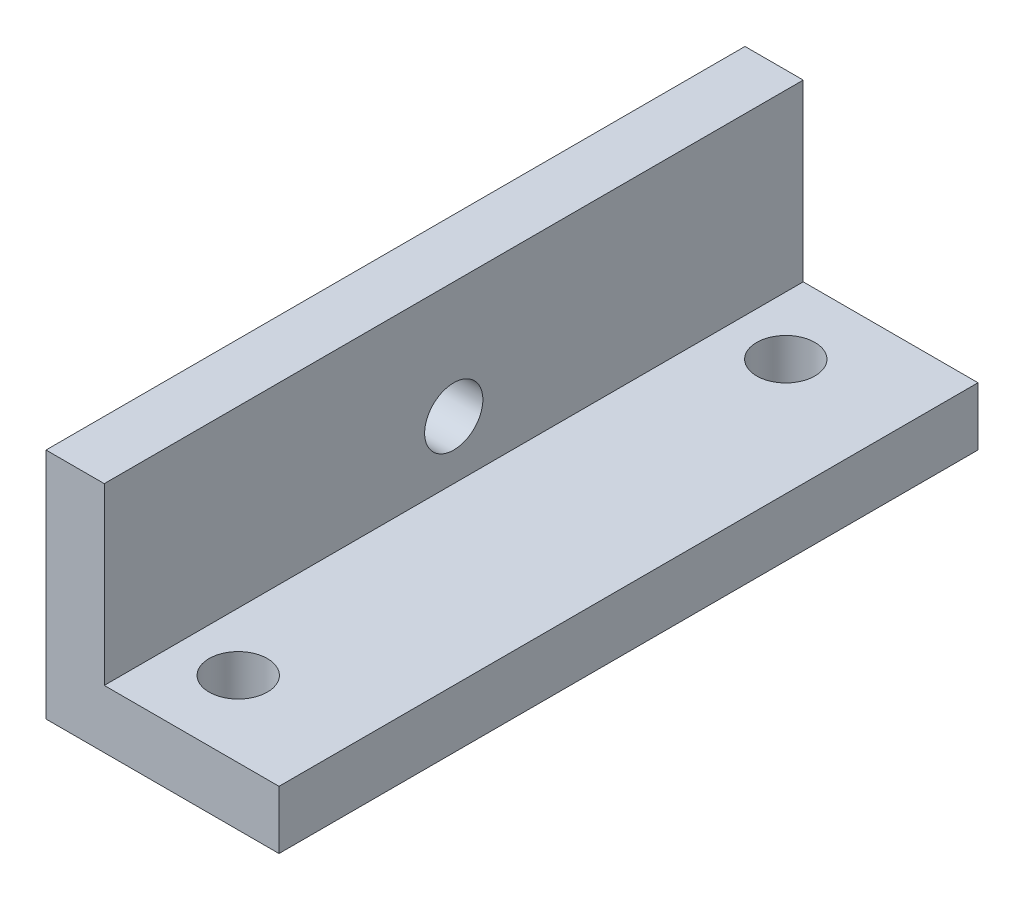
from build123d import *

# Parameters (mm, degrees)
BOSS_EXTRUDE1_DEPTH = 38.1
SKETCH2_R           = 1.5875
CUT_EXTRUDE1_DEPTH  = 43.121134838
SKETCH3_R           = 1.5875
CUT_EXTRUDE2_DEPTH  = 43.121134838


with BuildPart() as part:
    # Sketch1 → Boss-Extrude1 (new body)
    with BuildSketch(Plane.XY):
        Polygon((0, 12.7), (0, 0), (12.7, 0), (12.7, 3.175), (3.175, 3.175), (3.175, 12.7), align=None)
    extrude(amount=BOSS_EXTRUDE1_DEPTH)

    # Sketch2 → Cut-Extrude1 (cut, through all)
    with BuildSketch(Plane.ZY):
        with Locations((19.05, 6.35)):
            Circle(SKETCH2_R)
    extrude(amount=-CUT_EXTRUDE1_DEPTH, mode=Mode.SUBTRACT)

    # Sketch3 → Cut-Extrude2 (cut, through all)
    with BuildSketch(Plane.XZ):
        with Locations((6.35, 4.1275)):
            Circle(SKETCH3_R)
        with Locations((6.35, 33.9725)):
            Circle(SKETCH3_R)
    extrude(amount=-CUT_EXTRUDE2_DEPTH, mode=Mode.SUBTRACT)


solid = part.part
